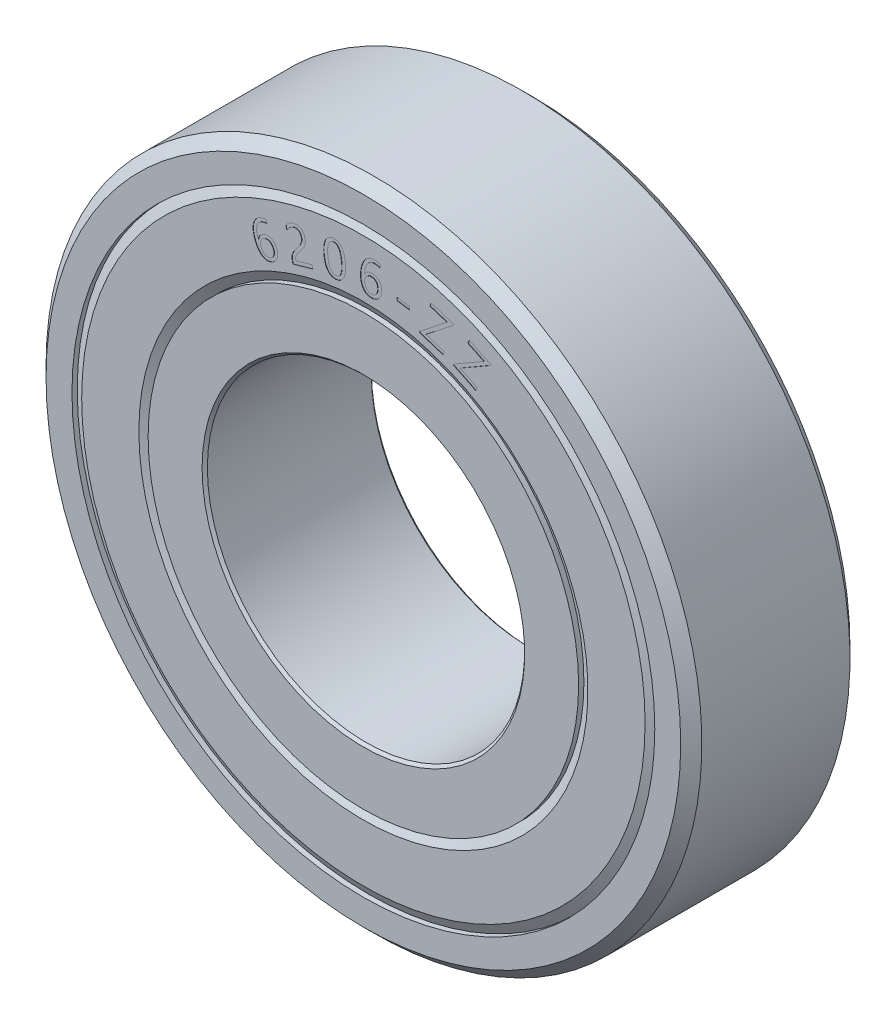
from build123d import *

# Parameters (mm, degrees)
WRAP1_START  = -0.03125
WRAP1_DEPTH  = 0.03125
SCALE2_SCALE = 0.564516129


# Read off the part's stored shape, not the designer's step: Wrap1
with BuildPart() as part:
    # Sketch1 → Revolve1 (revolve)
    with BuildSketch(Plane(origin=(0, 0, 0), x_dir=(0, 0, -1), z_dir=(1, 0, 0)), mode=Mode.PRIVATE) as revolve1_sk:
        Polygon((-15, 31), (-1, 31), (0, 30), (0, 27.55), (-0.5, 27.55), (0, 26.632766492), (0, 21.227178001), (-0.5, 20.35), (0, 20.35), (0, 15.25), (-0.25, 15), (-15.75, 15), (-16, 15.25), (-16, 20.35), (-15.5, 20.35), (-16, 21.227178001), (-16, 26.632766492), (-15.5, 27.55), (-16, 27.55), (-16, 30), align=None)
    revolve(revolve1_sk.sketch.rotate(Axis((0, 0, 0), (0, 0, 1)), 90), axis=Axis((0, 0, 0), (0, 0, 1)))

    # Wrap1 outline → Wrap1 (cut)
    # profile 1 of 7: a face of its own
    with BuildSketch(Plane.XY.offset(16).offset(WRAP1_START)):
        with BuildLine():
            add(Edge.make_bspline(
                [(-8.686815783, 20.117549912), (-8.722859253, 20.103195892), (-8.793303243, 20.075142142), (-8.902341071, 20.048318833), (-9.010387041, 20.035036667), (-9.117493542, 20.035487632), (-9.222631434, 20.05035074), (-9.325954759, 20.077121449), (-9.427100074, 20.117491532), (-9.526053483, 20.170719276), (-9.621873439, 20.236917247), (-9.714649586, 20.315724897), (-9.80465117, 20.406360164), (-9.890735386, 20.510296734), (-9.973382333, 20.625349673), (-10.050928825, 20.752581484), (-10.125874325, 20.889797402), (-10.169658996, 20.987351786), (-10.192068662, 21.037281614)],
                knots=[0, 0, 0, 0, 0.058625041, 0.114577812, 0.16927673, 0.222921005, 0.276072403, 0.32947385, 0.383986326, 0.440378705, 0.49907483, 0.5597953, 0.624256027, 0.69201223, 0.763706148, 0.838325487, 0.917252507, 1, 1, 1, 1], degree=3))
            add(Edge.make_bspline(
                [(-8.197249583, 21.482460479), (-8.182814772, 21.447469043), (-8.154474675, 21.378769792), (-8.124963946, 21.27265893), (-8.104053798, 21.167753573), (-8.095128489, 21.063350256), (-8.096006759, 20.961366535), (-8.104681526, 20.861836927), (-8.123812758, 20.765641411), (-8.152044208, 20.67283335), (-8.188253424, 20.583689078), (-8.234707833, 20.499496294), (-8.289418685, 20.419561321), (-8.35375917, 20.345389982), (-8.425272037, 20.276393507), (-8.505666518, 20.215845453), (-8.592679359, 20.161629725), (-8.655153947, 20.132375712), (-8.686815783, 20.117549912)],
                knots=[0, 0, 0, 0, 0.069936499, 0.13730746, 0.203276133, 0.267497732, 0.330668393, 0.391684228, 0.451970044, 0.511666229, 0.570843551, 0.629542941, 0.689140061, 0.749626942, 0.810812346, 0.872535145, 0.935401393, 1, 1, 1, 1], degree=3))
            add(Edge.make_bspline(
                [(-9.41398478, 22.01445575), (-9.38265969, 22.027264022), (-9.321603963, 22.052228623), (-9.227953703, 22.078517944), (-9.135599299, 22.094313007), (-9.044600249, 22.100079537), (-8.955272311, 22.09722025), (-8.868515037, 22.08374945), (-8.783987479, 22.062547391), (-8.702931612, 22.030495556), (-8.624468912, 21.991151698), (-8.550465264, 21.94193132), (-8.479256837, 21.885837175), (-8.41322184, 21.820250398), (-8.35058673, 21.747415808), (-8.293474439, 21.666501183), (-8.241383758, 21.577873998), (-8.212169109, 21.51471495), (-8.197249583, 21.482460479)],
                knots=[0, 0, 0, 0, 0.06789377, 0.132331738, 0.194804894, 0.255645807, 0.315089351, 0.373835547, 0.431572813, 0.489651074, 0.548449209, 0.607448177, 0.667750483, 0.730142659, 0.793958827, 0.86037386, 0.92869482, 1, 1, 1, 1], degree=3))
            add(Edge.make_bspline(
                [(-9.916606079, 21.366270101), (-9.912045259, 21.402609501), (-9.903113933, 21.473771912), (-9.87131608, 21.575060102), (-9.828298684, 21.668992957), (-9.771329205, 21.754693296), (-9.701331602, 21.832729558), (-9.617241393, 21.901571264), (-9.521665689, 21.964685496), (-9.450601051, 21.997531663), (-9.41398478, 22.01445575)],
                knots=[0, 0, 0, 0, 0.126822422, 0.248352732, 0.366544017, 0.484194201, 0.603918014, 0.728777904, 0.860251991, 1, 1, 1, 1], degree=3))
            Line((-9.916606079, 21.366270101), (-9.925091894, 21.362353571))
            add(Edge.make_bspline(
                [(-9.606547486, 22.944631532), (-9.637658803, 22.929971647), (-9.698886835, 22.901120543), (-9.782022458, 22.844896358), (-9.856190666, 22.780438308), (-9.920060125, 22.706985215), (-9.974778604, 22.626148933), (-10.018933176, 22.538125826), (-10.054521194, 22.443882253), (-10.080600753, 22.343480631), (-10.095991004, 22.236888903), (-10.101710316, 22.125025736), (-10.097446228, 22.007589072), (-10.083802216, 21.88512279), (-10.059334292, 21.758665835), (-10.02501889, 21.628745783), (-9.980942, 21.495569991), (-9.943969085, 21.407380376), (-9.925091894, 21.362353571)],
                knots=[0, 0, 0, 0, 0.057119755, 0.11241344, 0.166260519, 0.220107598, 0.273796414, 0.328166104, 0.383472809, 0.441042306, 0.500297207, 0.562254393, 0.627056894, 0.695502473, 0.76696116, 0.841031333, 0.91883567, 1, 1, 1, 1], degree=3))
            add(Edge.make_bspline(
                [(-9.083690783, 23.034711713), (-9.128989335, 23.036360887), (-9.218778327, 23.039629815), (-9.351904134, 23.023172447), (-9.482345795, 22.994163664), (-9.564921156, 22.961232279), (-9.606547486, 22.944631532)],
                knots=[0, 0, 0, 0, 0.253592012, 0.502660037, 0.749290378, 1, 1, 1, 1], degree=3))
            Line((-9.083690783, 23.034711713), (-9.220116565, 23.348034081))
            add(Edge.make_bspline(
                [(-9.737098473, 23.222052379), (-9.712588352, 23.232464798), (-9.665013108, 23.252675771), (-9.594122018, 23.27917572), (-9.525463719, 23.300284479), (-9.459725925, 23.319051272), (-9.396288939, 23.332854956), (-9.335217444, 23.341938466), (-9.276794742, 23.347475988), (-9.238622491, 23.347851859), (-9.220116565, 23.348034081)],
                knots=[0, 0, 0, 0, 0.149049533, 0.289311835, 0.423355869, 0.551000849, 0.671871767, 0.786410566, 0.896451737, 1, 1, 1, 1], degree=3))
            add(Edge.make_bspline(
                [(-10.192068662, 21.037281614), (-10.21793268, 21.099191903), (-10.268551991, 21.220358545), (-10.32866129, 21.4036111), (-10.376803532, 21.582069301), (-10.40835121, 21.756376293), (-10.427402089, 21.924981836), (-10.431130458, 22.087018372), (-10.422531467, 22.241932468), (-10.399798993, 22.389348308), (-10.363521043, 22.528590933), (-10.313491732, 22.659016381), (-10.250772952, 22.780704547), (-10.17401686, 22.892695699), (-10.084496137, 22.994668726), (-9.980964194, 23.083694787), (-9.865150782, 23.161369657), (-9.780323436, 23.201568497), (-9.737098473, 23.222052379)],
                knots=[0, 0, 0, 0, 0.080647521, 0.157837891, 0.231704099, 0.30272489, 0.370620794, 0.435523077, 0.497375405, 0.556949247, 0.61456941, 0.670056373, 0.724585825, 0.778793611, 0.832915465, 0.887258822, 0.942551153, 1, 1, 1, 1], degree=3))
        make_face()
        with BuildLine():
            add(Edge.make_bspline(
                [(-9.36633367, 21.701786137), (-9.386359326, 21.692417938), (-9.425705507, 21.674011409), (-9.480160881, 21.639462231), (-9.530303183, 21.600888479), (-9.575256578, 21.557147313), (-9.614617436, 21.509445932), (-9.650054055, 21.459747964), (-9.678384839, 21.406285343), (-9.702862752, 21.351082946), (-9.721092458, 21.293485969), (-9.733438754, 21.23419742), (-9.740732361, 21.173699926), (-9.74197743, 21.112050891), (-9.737397725, 21.050202246), (-9.727024979, 20.988488017), (-9.709996881, 20.927493903), (-9.694171849, 20.888102387), (-9.686183588, 20.868218086)],
                knots=[0, 0, 0, 0, 0.066694962, 0.1310415, 0.194251108, 0.257436812, 0.319935694, 0.38080777, 0.441367059, 0.502271034, 0.562940694, 0.623371559, 0.684896011, 0.746665513, 0.809247212, 0.871890951, 0.935332296, 1, 1, 1, 1], degree=3))
            add(Edge.make_bspline(
                [(-8.51840501, 21.292508793), (-8.5296007, 21.3170435), (-8.551354064, 21.36471474), (-8.588931372, 21.432042197), (-8.629793445, 21.493138852), (-8.673736117, 21.548343549), (-8.720212962, 21.597514151), (-8.768843529, 21.640788122), (-8.820486027, 21.677013213), (-8.873960489, 21.707233972), (-8.929806854, 21.73083394), (-8.987539229, 21.748158542), (-9.047440885, 21.757678689), (-9.108951541, 21.761185101), (-9.171946366, 21.75682767), (-9.236358722, 21.746570867), (-9.301766679, 21.728162416), (-9.344514273, 21.710699585), (-9.36633367, 21.701786137)],
                knots=[0, 0, 0, 0, 0.075921985, 0.14751736, 0.216853669, 0.282690345, 0.345971109, 0.407186124, 0.465665977, 0.523275869, 0.579836756, 0.636061433, 0.692572514, 0.750250794, 0.80918789, 0.870030717, 0.933660562, 1, 1, 1, 1], degree=3))
            add(Edge.make_bspline(
                [(-8.795825857, 20.406067593), (-8.775560354, 20.415394951), (-8.735641396, 20.433767967), (-8.681087075, 20.468787022), (-8.631193841, 20.507425206), (-8.587619402, 20.551474758), (-8.549003066, 20.599063528), (-8.516164747, 20.649980863), (-8.489992805, 20.704302907), (-8.468973646, 20.761078452), (-8.453969464, 20.820830287), (-8.444905871, 20.882936565), (-8.441678896, 20.947408925), (-8.444475717, 21.014006585), (-8.45276162, 21.082434148), (-8.468161234, 21.152026534), (-8.489476269, 21.222659195), (-8.5086442, 21.268940929), (-8.51840501, 21.292508793)],
                knots=[0, 0, 0, 0, 0.064137033, 0.126337031, 0.186096352, 0.245434177, 0.304214204, 0.362235401, 0.419371141, 0.477422746, 0.536202773, 0.596338261, 0.657789751, 0.721715479, 0.787972893, 0.855899167, 0.926620104, 1, 1, 1, 1], degree=3))
            add(Edge.make_bspline(
                [(-9.686183588, 20.868218086), (-9.675036646, 20.843871081), (-9.653132691, 20.796028745), (-9.613970828, 20.728320193), (-9.571284604, 20.664853471), (-9.523406352, 20.606932785), (-9.472646905, 20.554031168), (-9.419267315, 20.506890409), (-9.363087114, 20.46622069), (-9.305453816, 20.430601405), (-9.245035442, 20.402664249), (-9.183229139, 20.380816862), (-9.120009196, 20.365722668), (-9.055434728, 20.357926796), (-8.990101375, 20.356875775), (-8.924630606, 20.365155361), (-8.859111454, 20.380520524), (-8.817178356, 20.397448037), (-8.795825857, 20.406067593)],
                knots=[0, 0, 0, 0, 0.071810448, 0.141108922, 0.209603514, 0.276804573, 0.342453494, 0.406160557, 0.467582333, 0.528357017, 0.587644182, 0.645805392, 0.70400468, 0.761644941, 0.820028409, 0.878827795, 0.938298637, 1, 1, 1, 1], degree=3))
        make_face(mode=Mode.SUBTRACT)
    # profile 2 of 7: a face of its own
    with BuildSketch(Plane.XY.offset(16).offset(WRAP1_START)):
        with BuildLine():
            add(Edge.make_bspline(
                [(0.707680968, 21.901129933), (0.669042669, 21.903137915), (0.593316991, 21.907073279), (0.483804794, 21.930514225), (0.380056427, 21.963115662), (0.283713007, 22.010090335), (0.194582083, 22.06839335), (0.113051858, 22.13789865), (0.038257743, 22.217070291), (-0.028698729, 22.307359166), (-0.087302221, 22.408167188), (-0.137475825, 22.51922493), (-0.179727656, 22.639844993), (-0.214524532, 22.770026352), (-0.239336419, 22.909832536), (-0.256302485, 23.058057614), (-0.264093564, 23.214612925), (-0.262485121, 23.321520458), (-0.261660109, 23.376356085)],
                knots=[0, 0, 0, 0, 0.058389355, 0.114434994, 0.168721187, 0.222406407, 0.275856428, 0.32929026, 0.383960576, 0.440129574, 0.4987878, 0.559861289, 0.624035465, 0.691759102, 0.763293468, 0.838431909, 0.917127566, 1, 1, 1, 1], degree=3))
            add(Edge.make_bspline(
                [(1.73315897, 22.9285662), (1.731317501, 22.890629486), (1.727700362, 22.816111551), (1.709217137, 22.707456812), (1.683600927, 22.603415751), (1.647558598, 22.505206699), (1.603583706, 22.413063743), (1.553417837, 22.326708001), (1.495107545, 22.247774057), (1.430209561, 22.175612626), (1.359092525, 22.110554811), (1.280809715, 22.054373304), (1.196833235, 22.005878222), (1.107340143, 21.965201977), (1.012779084, 21.934067417), (0.914202376, 21.912222984), (0.811949494, 21.901189608), (0.742734971, 21.901149995), (0.707680968, 21.901129933)],
                knots=[0, 0, 0, 0, 0.070070298, 0.137636957, 0.203115814, 0.2676787, 0.330395244, 0.391442525, 0.451787784, 0.511242502, 0.570399214, 0.629385156, 0.688784197, 0.749197621, 0.810560032, 0.872263436, 0.93530725, 1, 1, 1, 1], degree=3))
            add(Edge.make_bspline(
                [(0.859120113, 23.928586759), (0.892694849, 23.926878689), (0.958695752, 23.92352098), (1.054479383, 23.90692302), (1.144998179, 23.881971036), (1.229923053, 23.848763048), (1.309208798, 23.807388775), (1.382697097, 23.75907912), (1.449706708, 23.703248161), (1.509949466, 23.64025254), (1.563454234, 23.570709533), (1.610890351, 23.49561163), (1.650013871, 23.41367974), (1.682511893, 23.326297698), (1.708133672, 23.233764829), (1.724845765, 23.136035282), (1.734379575, 23.033852062), (1.733570364, 22.964051902), (1.73315897, 22.9285662)],
                knots=[0, 0, 0, 0, 0.067410169, 0.13251428, 0.194589033, 0.255560699, 0.315123183, 0.373733896, 0.431705252, 0.489760401, 0.548273457, 0.607513411, 0.667658746, 0.730105515, 0.79440083, 0.860009553, 0.928830258, 1, 1, 1, 1], degree=3))
            add(Edge.make_bspline(
                [(0.126729077, 23.555863692), (0.146566339, 23.586722802), (0.185259214, 23.646913954), (0.256598664, 23.725609145), (0.335807691, 23.792243176), (0.424207077, 23.845563944), (0.521149352, 23.885594408), (0.626182748, 23.91370664), (0.740091471, 23.928742576), (0.818607648, 23.928639793), (0.859120113, 23.928586759)],
                knots=[0, 0, 0, 0, 0.126868955, 0.247459778, 0.366228683, 0.484218121, 0.603452259, 0.728297714, 0.859808133, 1, 1, 1, 1], degree=3))
            Line((0.126729077, 23.555863692), (0.117590507, 23.556516447))
            add(Edge.make_bspline(
                [(1.08105679, 24.853540501), (1.046619704, 24.853327651), (0.978908288, 24.852909138), (0.87958819, 24.837250734), (0.784748564, 24.810890107), (0.695703436, 24.770905318), (0.611837001, 24.721428015), (0.534018255, 24.6608926), (0.461490584, 24.591149012), (0.39530933, 24.510887806), (0.336191689, 24.421105397), (0.282878028, 24.322478008), (0.236898329, 24.214391409), (0.19702328, 24.09776186), (0.165450549, 23.97257542), (0.140562519, 23.840312734), (0.124218283, 23.700701101), (0.119832794, 23.605296498), (0.117590507, 23.556516447)],
                knots=[0, 0, 0, 0, 0.057153846, 0.112377914, 0.166510623, 0.220254359, 0.274075872, 0.327952004, 0.383694398, 0.440957922, 0.500421996, 0.56205684, 0.62700152, 0.695374093, 0.766666835, 0.841336777, 0.91887603, 1, 1, 1, 1], degree=3))
            add(Edge.make_bspline(
                [(1.592163904, 24.71189268), (1.551940073, 24.732555796), (1.472181966, 24.7735278), (1.344975137, 24.815654217), (1.214676731, 24.845543132), (1.125826894, 24.850860938), (1.08105679, 24.853540501)],
                knots=[0, 0, 0, 0, 0.253114679, 0.501890232, 0.749009943, 1, 1, 1, 1], degree=3))
            Line((1.592163904, 24.71189268), (1.602607983, 25.053283511))
            add(Edge.make_bspline(
                [(1.08105679, 25.159682565), (1.107614517, 25.158589432), (1.159270301, 25.156463247), (1.234829849, 25.149809319), (1.306261353, 25.14077106), (1.373729722, 25.129446236), (1.436666264, 25.113803495), (1.496057432, 25.097531984), (1.551190532, 25.077179657), (1.585734943, 25.061125218), (1.602607983, 25.053283511)],
                knots=[0, 0, 0, 0, 0.148703102, 0.289233159, 0.424228116, 0.551521341, 0.671699774, 0.786916864, 0.895920644, 1, 1, 1, 1], degree=3))
            add(Edge.make_bspline(
                [(-0.261660109, 23.376356085), (-0.258515414, 23.443425865), (-0.25236423, 23.574617768), (-0.230343463, 23.766175341), (-0.196292104, 23.947817131), (-0.15160386, 24.11937121), (-0.096329089, 24.279754808), (-0.031714794, 24.428450391), (0.042855691, 24.56437758), (0.125603315, 24.688613161), (0.217667151, 24.79919183), (0.318207671, 24.896189142), (0.427325006, 24.978983713), (0.5442674, 25.047990243), (0.669373931, 25.101191993), (0.800883961, 25.138447443), (0.939156455, 25.159393198), (1.033118077, 25.159584807), (1.08105679, 25.159682565)],
                knots=[0, 0, 0, 0, 0.080677799, 0.157809879, 0.231509189, 0.302609793, 0.370669291, 0.435188578, 0.497213011, 0.556756917, 0.614310713, 0.669793215, 0.72428962, 0.77855592, 0.832566452, 0.887199453, 0.942449769, 1, 1, 1, 1], degree=3))
        make_face()
        with BuildLine():
            add(Edge.make_bspline(
                [(0.768387177, 23.625055715), (0.746399512, 23.625010818), (0.702947513, 23.624922093), (0.638684197, 23.618006817), (0.576971492, 23.603089397), (0.517508977, 23.583256789), (0.461775932, 23.556728429), (0.40852988, 23.526854035), (0.36005899, 23.490669135), (0.314576601, 23.45077217), (0.273571096, 23.40664654), (0.237552303, 23.358080927), (0.204517408, 23.306866648), (0.177375154, 23.251299257), (0.15540482, 23.193322302), (0.137790422, 23.13346698), (0.127616185, 23.071181561), (0.124858318, 23.02890414), (0.123465302, 23.007549547)],
                knots=[0, 0, 0, 0, 0.066393817, 0.131207386, 0.194657015, 0.257840578, 0.320177571, 0.38082871, 0.441955161, 0.502485104, 0.563409824, 0.623481308, 0.684928451, 0.747241187, 0.809858193, 0.872059917, 0.935376652, 1, 1, 1, 1], degree=3))
            add(Edge.make_bspline(
                [(1.361741412, 22.893317433), (1.361824473, 22.920084099), (1.3619874, 22.972587451), (1.35714076, 23.049464116), (1.345848684, 23.1223265), (1.329729122, 23.191186597), (1.308027356, 23.255414181), (1.282933903, 23.315826659), (1.251311082, 23.370356351), (1.215829611, 23.420499349), (1.176203335, 23.466098299), (1.130351807, 23.505170922), (1.080885986, 23.540202354), (1.026062396, 23.568849982), (0.967455296, 23.592260839), (0.904764796, 23.610204009), (0.83793867, 23.621180666), (0.791925209, 23.623744297), (0.768387177, 23.625055715)],
                knots=[0, 0, 0, 0, 0.075352881, 0.147806187, 0.216598188, 0.282719789, 0.346648263, 0.407299232, 0.466566966, 0.523680661, 0.5801002, 0.636115867, 0.692876933, 0.75042593, 0.80980753, 0.870309815, 0.933657417, 1, 1, 1, 1], degree=3))
            add(Edge.make_bspline(
                [(0.73313841, 22.208577507), (0.755355448, 22.208531428), (0.799073565, 22.208440755), (0.863413425, 22.216585243), (0.924990926, 22.230743158), (0.983353463, 22.251867115), (1.038235948, 22.278644446), (1.089475031, 22.31077838), (1.136737519, 22.348221521), (1.180060681, 22.390910559), (1.218960876, 22.438554368), (1.254145505, 22.490558393), (1.283857661, 22.547750459), (1.310091147, 22.609197421), (1.331677461, 22.674851105), (1.347122379, 22.744628668), (1.35775355, 22.817738163), (1.360396311, 22.867824642), (1.361741412, 22.893317433)],
                knots=[0, 0, 0, 0, 0.063863538, 0.125669034, 0.18610247, 0.245307623, 0.303820372, 0.361483109, 0.418968883, 0.476956904, 0.536109083, 0.595660709, 0.65726616, 0.721215545, 0.787730041, 0.855764831, 0.926587831, 1, 1, 1, 1], degree=3))
            add(Edge.make_bspline(
                [(0.123465302, 23.007549547), (0.123230364, 22.980770143), (0.122767336, 22.927991753), (0.129906684, 22.849941119), (0.140982507, 22.774011406), (0.159748999, 22.701067469), (0.182550692, 22.631336419), (0.212208923, 22.566406574), (0.244039346, 22.504752788), (0.282226401, 22.448496007), (0.324789805, 22.397485129), (0.371329951, 22.351253331), (0.422560495, 22.310920204), (0.477147764, 22.275168846), (0.53630158, 22.247201344), (0.59884559, 22.225933029), (0.664963471, 22.21290305), (0.71023786, 22.210030494), (0.73313841, 22.208577507)],
                knots=[0, 0, 0, 0, 0.071690568, 0.1412919, 0.209709395, 0.276995448, 0.342793415, 0.405935819, 0.467990205, 0.528447497, 0.587624209, 0.645735108, 0.703807999, 0.762009434, 0.820143711, 0.878569419, 0.938578362, 1, 1, 1, 1], degree=3))
        make_face(mode=Mode.SUBTRACT)
    # profile 3 of 7: a face of its own
    with BuildSketch(Plane.XY.offset(16).offset(WRAP1_START)):
        with BuildLine():
            add(Edge.make_bspline(
                [(-2.572297646, 21.745813176), (-2.610796657, 21.742786653), (-2.686115637, 21.736865603), (-2.797364409, 21.746218194), (-2.90362292, 21.767510526), (-3.004823896, 21.802849566), (-3.099934037, 21.852534468), (-3.18937498, 21.914159753), (-3.272045397, 21.989114764), (-3.349354829, 22.075532988), (-3.4199735, 22.174854024), (-3.483557513, 22.286510405), (-3.542075031, 22.409545364), (-3.592286088, 22.545220711), (-3.6370898, 22.692198529), (-3.67247588, 22.851289232), (-3.7041215, 23.020951818), (-3.717524014, 23.138467275), (-3.724410105, 23.198845659)],
                knots=[0, 0, 0, 0, 0.055591359, 0.108758234, 0.160309058, 0.211497889, 0.262704016, 0.314561211, 0.367649379, 0.423185844, 0.481417946, 0.542967689, 0.608211854, 0.677598235, 0.751326758, 0.829546457, 0.912422504, 1, 1, 1, 1], degree=3))
            add(Edge.make_bspline(
                [(-1.693689505, 23.489321605), (-1.687741888, 23.42561774), (-1.676167649, 23.301648114), (-1.671310788, 23.120080511), (-1.675435274, 22.948771533), (-1.689530489, 22.787805885), (-1.713411808, 22.637687855), (-1.746624696, 22.498375502), (-1.788838313, 22.370030476), (-1.840106464, 22.252513666), (-1.901338341, 22.146833702), (-1.970203791, 22.051576565), (-2.050313349, 21.969690091), (-2.13796913, 21.898452858), (-2.234743334, 21.839809669), (-2.340042833, 21.79479672), (-2.453267106, 21.762271957), (-2.532075229, 21.751374874), (-2.572297646, 21.745813176)],
                knots=[0, 0, 0, 0, 0.087585536, 0.17044407, 0.248529309, 0.32211233, 0.391516987, 0.456479845, 0.518001271, 0.576293412, 0.631687369, 0.684959197, 0.736790272, 0.78806522, 0.839262209, 0.891174565, 0.944457222, 1, 1, 1, 1], degree=3))
            add(Edge.make_bspline(
                [(-2.846454719, 24.990005199), (-2.806445318, 24.993177421), (-2.728797961, 24.999333842), (-2.614222207, 24.991834203), (-2.50644679, 24.970878127), (-2.404217062, 24.937937778), (-2.309777604, 24.889068578), (-2.220548087, 24.828880623), (-2.138569332, 24.753863264), (-2.06263159, 24.666112881), (-1.994240269, 24.564370537), (-1.931298862, 24.450246201), (-1.875604095, 24.322455407), (-1.825986686, 24.181505298), (-1.783470373, 24.027147408), (-1.746347206, 23.859857312), (-1.715548727, 23.679256925), (-1.701136165, 23.554025819), (-1.693689505, 23.489321605)],
                knots=[0, 0, 0, 0, 0.056329036, 0.109319327, 0.160697138, 0.210286926, 0.259638717, 0.30957776, 0.361087262, 0.415265123, 0.47224155, 0.53298908, 0.598137278, 0.667844842, 0.742754497, 0.822926167, 0.908509766, 1, 1, 1, 1], degree=3))
            add(Edge.make_bspline(
                [(-3.724410105, 23.198845659), (-3.73041768, 23.265383213), (-3.742064776, 23.394381897), (-3.749703824, 23.583052496), (-3.746235338, 23.760415966), (-3.734704904, 23.926880301), (-3.711627773, 24.081906662), (-3.68028576, 24.225447314), (-3.639187386, 24.357364818), (-3.588226657, 24.4771833), (-3.528649717, 24.585822893), (-3.457930174, 24.68129883), (-3.37868509, 24.76505334), (-3.289720884, 24.836206122), (-3.191519378, 24.894771183), (-3.084401488, 24.940465954), (-2.96860192, 24.973757026), (-2.887775158, 24.984508703), (-2.846454719, 24.990005199)],
                knots=[0, 0, 0, 0, 0.089294896, 0.17311914, 0.252242165, 0.326323021, 0.396000729, 0.461554359, 0.522540886, 0.580398444, 0.635343397, 0.687755128, 0.738773238, 0.789055673, 0.839533717, 0.891128059, 0.944342241, 1, 1, 1, 1], degree=3))
        make_face()
        with BuildLine():
            add(Edge.make_bspline(
                [(-2.83209411, 24.68451589), (-2.859258762, 24.680810054), (-2.912105842, 24.67360059), (-2.986983831, 24.648502103), (-3.055608953, 24.614342065), (-3.118464366, 24.570452001), (-3.17379168, 24.51497578), (-3.222852466, 24.449900664), (-3.265347583, 24.374755475), (-3.300959704, 24.289803558), (-3.331069894, 24.19526969), (-3.354280265, 24.090381987), (-3.370678846, 23.975361345), (-3.382036502, 23.85052799), (-3.385240224, 23.715616824), (-3.383091661, 23.570837569), (-3.375639966, 23.415736142), (-3.365014058, 23.309340201), (-3.359520097, 23.254329829)],
                knots=[0, 0, 0, 0, 0.048460173, 0.094276144, 0.139079573, 0.183873059, 0.229375235, 0.277232686, 0.327797928, 0.381833645, 0.440082181, 0.503274858, 0.571827387, 0.645714674, 0.725124503, 0.81067362, 0.902111729, 1, 1, 1, 1], degree=3))
            add(Edge.make_bspline(
                [(-2.056621248, 23.415560298), (-2.062744905, 23.469358116), (-2.074622389, 23.573704713), (-2.098478993, 23.724273071), (-2.124459493, 23.864333143), (-2.156185496, 23.992877452), (-2.190020221, 24.110936545), (-2.229570765, 24.21751713), (-2.271512926, 24.313842088), (-2.31765416, 24.399442788), (-2.368671937, 24.473452811), (-2.423110795, 24.537025016), (-2.481370091, 24.589946562), (-2.544002669, 24.63172255), (-2.610762322, 24.662254757), (-2.681328631, 24.681206618), (-2.755810881, 24.689328961), (-2.806200532, 24.686149639), (-2.83209411, 24.68451589)],
                knots=[0, 0, 0, 0, 0.098545731, 0.191139937, 0.277438299, 0.357744763, 0.432061694, 0.500854239, 0.564512789, 0.623179147, 0.677560643, 0.727822819, 0.775219463, 0.820366822, 0.864322339, 0.908229652, 0.952842249, 1, 1, 1, 1], degree=3))
            add(Edge.make_bspline(
                [(-2.569033872, 22.05587177), (-2.54298237, 22.059453803), (-2.492009565, 22.06646247), (-2.419401873, 22.089875648), (-2.352940897, 22.122616123), (-2.292548286, 22.165065255), (-2.23859226, 22.217386082), (-2.19082025, 22.279210247), (-2.14959896, 22.350715779), (-2.114441319, 22.43129199), (-2.085957198, 22.521524135), (-2.063370622, 22.621102947), (-2.0464326, 22.730359874), (-2.036560547, 22.849220453), (-2.031882072, 22.977529134), (-2.034375827, 23.115170048), (-2.042095678, 23.26236585), (-2.051672598, 23.363369179), (-2.056621248, 23.415560298)],
                knots=[0, 0, 0, 0, 0.048710566, 0.095307912, 0.140801117, 0.185710312, 0.231673891, 0.279717526, 0.33018932, 0.384415126, 0.442500286, 0.505463908, 0.573689088, 0.647440568, 0.726610532, 0.811793726, 0.902748789, 1, 1, 1, 1], degree=3))
            add(Edge.make_bspline(
                [(-3.359520097, 23.254329829), (-3.353605965, 23.203144711), (-3.342177106, 23.104231205), (-3.319133782, 22.961406043), (-3.292628021, 22.828944288), (-3.262290819, 22.706554624), (-3.227243322, 22.594904286), (-3.187926986, 22.4937515), (-3.145315248, 22.402524862), (-3.09753744, 22.321950005), (-3.04625827, 22.251434766), (-2.990091904, 22.192065389), (-2.930484009, 22.142173322), (-2.865900841, 22.103437366), (-2.797385447, 22.07467789), (-2.724545641, 22.058169953), (-2.647895978, 22.050339617), (-2.595798194, 22.053994261), (-2.569033872, 22.05587177)],
                knots=[0, 0, 0, 0, 0.096516094, 0.186514084, 0.270930708, 0.349525354, 0.422620362, 0.489989114, 0.55271016, 0.611011903, 0.665226205, 0.715686548, 0.763753996, 0.810380925, 0.85625344, 0.902326537, 0.949821971, 1, 1, 1, 1], degree=3))
        make_face(mode=Mode.SUBTRACT)
    # profile 4 of 7: a face of its own
    with BuildSketch(Plane.XY.offset(16).offset(WRAP1_START)):
        with BuildLine():
            add(Edge.make_bspline(
                [(-6.601340088, 24.001248637), (-6.634610472, 23.990507465), (-6.701197779, 23.969010095), (-6.793835638, 23.91845711), (-6.88117587, 23.858063427), (-6.962737117, 23.787495492), (-7.0378873, 23.707076731), (-7.107327289, 23.619346873), (-7.170705012, 23.524703409), (-7.205765317, 23.456994236), (-7.223415541, 23.422907765)],
                knots=[0, 0, 0, 0, 0.119855874, 0.239879411, 0.360747019, 0.484211769, 0.609517769, 0.738264798, 0.868236033, 1, 1, 1, 1], degree=3))
            add(Edge.make_bspline(
                [(-5.883309661, 23.607637412), (-5.890353503, 23.629954638), (-5.904089989, 23.673476377), (-5.929910882, 23.734647565), (-5.960331589, 23.789785246), (-5.994865356, 23.838705334), (-6.03305387, 23.881895412), (-6.073484914, 23.920297549), (-6.117455165, 23.952353904), (-6.164062084, 23.978539581), (-6.212769012, 23.999266696), (-6.263162413, 24.016427124), (-6.316455799, 24.025389939), (-6.371214878, 24.030996997), (-6.42758452, 24.030599747), (-6.485025346, 24.026245285), (-6.543294733, 24.016331238), (-6.581823491, 24.006319862), (-6.601340088, 24.001248637)],
                knots=[0, 0, 0, 0, 0.075759873, 0.147742445, 0.214607958, 0.279318811, 0.341229975, 0.40105291, 0.459541336, 0.51696317, 0.573772152, 0.630816621, 0.688861946, 0.74831858, 0.808916648, 0.871119838, 0.934716237, 1, 1, 1, 1], degree=3))
            add(Edge.make_bspline(
                [(-6.207728863, 22.542341359), (-6.186692099, 22.569425358), (-6.146058381, 22.621739657), (-6.089442598, 22.699597031), (-6.040142373, 22.774512705), (-5.996282062, 22.846088566), (-5.959178375, 22.915878887), (-5.925998135, 22.983127978), (-5.900132092, 23.04979799), (-5.878212756, 23.114343815), (-5.86172752, 23.178032995), (-5.850617809, 23.240665212), (-5.844539153, 23.302233257), (-5.844061742, 23.383271393), (-5.85299068, 23.486104392), (-5.873048522, 23.566505846), (-5.883309661, 23.607637412)],
                knots=[0, 0, 0, 0, 0.088400926, 0.170751464, 0.248065885, 0.319536114, 0.387040428, 0.451763508, 0.512693579, 0.571224616, 0.627408185, 0.682090682, 0.73505479, 0.786659075, 0.890859604, 1, 1, 1, 1], degree=3))
            add(Edge.make_bspline(
                [(-6.693378534, 21.112808053), (-6.701804731, 21.144485294), (-6.718207572, 21.206149738), (-6.7358847, 21.297481627), (-6.74659573, 21.384508563), (-6.750093032, 21.467918085), (-6.746141876, 21.549188943), (-6.734812316, 21.629962164), (-6.716767004, 21.710905362), (-6.690105763, 21.792027561), (-6.655509792, 21.873913137), (-6.614525427, 21.958267531), (-6.565214702, 22.044301316), (-6.508382052, 22.133104424), (-6.443578877, 22.226146827), (-6.37189483, 22.325744611), (-6.292943438, 22.43235534), (-6.236809513, 22.504807112), (-6.207728863, 22.542341359)],
                knots=[0, 0, 0, 0, 0.061980301, 0.120653841, 0.175779782, 0.227671316, 0.278347685, 0.329445027, 0.381757465, 0.434982907, 0.490695539, 0.549773198, 0.612248783, 0.678117974, 0.749118099, 0.826663046, 0.910201339, 1, 1, 1, 1], degree=3))
            Line((-6.693378534, 21.112808053), (-6.650296709, 20.962021663))
            Line((-6.650296709, 20.962021663), (-4.772320763, 21.49728071))
            Line((-4.772320763, 21.49728071), (-4.861095434, 21.809297568))
            Line((-4.861095434, 21.809297568), (-6.376139636, 21.377173802))
            add(Edge.make_bspline(
                [(-5.902892309, 22.452261178), (-5.930228801, 22.418208738), (-5.982522708, 22.353067419), (-6.055280134, 22.258018339), (-6.121593894, 22.172089427), (-6.179910099, 22.09331466), (-6.231812695, 22.021272203), (-6.275612304, 21.952834833), (-6.313695879, 21.888712543), (-6.344866274, 21.827512191), (-6.369164004, 21.768991985), (-6.388091046, 21.712636347), (-6.399489661, 21.657582699), (-6.406560345, 21.603901016), (-6.407173507, 21.549790649), (-6.401324723, 21.49420236), (-6.391957131, 21.436031087), (-6.381498332, 21.397113639), (-6.376139636, 21.377173802)],
                knots=[0, 0, 0, 0, 0.106586134, 0.203896147, 0.292171502, 0.371521177, 0.443140967, 0.508846961, 0.569786444, 0.625129514, 0.676320817, 0.724356612, 0.769983044, 0.813329944, 0.856353514, 0.901697772, 0.949633633, 1, 1, 1, 1], degree=3))
            add(Edge.make_bspline(
                [(-5.537349546, 23.738188399), (-5.529248106, 23.708708463), (-5.51340679, 23.651064269), (-5.498358187, 23.564697799), (-5.487932182, 23.481274447), (-5.484847132, 23.400064684), (-5.487404998, 23.320660786), (-5.495760422, 23.242244471), (-5.511171, 23.164718342), (-5.531387445, 23.087243912), (-5.557465115, 23.009886326), (-5.59058574, 22.933062058), (-5.62839636, 22.855419855), (-5.673080489, 22.777982968), (-5.723413749, 22.699546862), (-5.777181787, 22.618034647), (-5.838190897, 22.535743129), (-5.881031859, 22.480466946), (-5.902892309, 22.452261178)],
                knots=[0, 0, 0, 0, 0.065483489, 0.128044476, 0.187676471, 0.245544914, 0.301998286, 0.357818364, 0.414335252, 0.471226015, 0.529325082, 0.589084562, 0.650395748, 0.714306355, 0.780540948, 0.85012003, 0.923520774, 1, 1, 1, 1], degree=3))
            add(Edge.make_bspline(
                [(-6.642463649, 24.308696211), (-6.611680591, 24.316821309), (-6.551242612, 24.332773736), (-6.459926195, 24.347647542), (-6.370188949, 24.355100872), (-6.282201676, 24.354178785), (-6.196408204, 24.346995646), (-6.114130763, 24.33021225), (-6.034875074, 24.307060333), (-5.959958955, 24.274530264), (-5.888113278, 24.235894073), (-5.822168726, 24.187202138), (-5.759427712, 24.132368692), (-5.70230019, 24.068902089), (-5.650247334, 23.998076332), (-5.60515631, 23.918970045), (-5.566266715, 23.832036354), (-5.547143331, 23.769973209), (-5.537349546, 23.738188399)],
                knots=[0, 0, 0, 0, 0.068112827, 0.133729457, 0.197739725, 0.260614921, 0.321880912, 0.381706751, 0.440055045, 0.498273084, 0.55622038, 0.614259309, 0.673318867, 0.734315198, 0.796634249, 0.861102034, 0.928865263, 1, 1, 1, 1], degree=3))
            add(Edge.make_bspline(
                [(-7.329814595, 23.796283588), (-7.311483767, 23.826284302), (-7.275277872, 23.885539819), (-7.210871155, 23.966712351), (-7.141272155, 24.041491835), (-7.063682237, 24.109248017), (-6.976110382, 24.170181839), (-6.876523199, 24.224140523), (-6.76423852, 24.271251963), (-6.684048473, 24.295909398), (-6.642463649, 24.308696211)],
                knots=[0, 0, 0, 0, 0.119596323, 0.236219113, 0.352039226, 0.467022429, 0.586211989, 0.714503794, 0.851947843, 1, 1, 1, 1], degree=3))
            Line((-7.329814595, 23.796283588), (-7.223415541, 23.422907765))
        make_face()
    # profile 5 of 7: a face of its own
    with BuildSketch(Plane.XY.offset(16).offset(WRAP1_START)):
        Polygon((7.645703332, 20.945337925), (5.922430306, 21.498874109), (8.524964228, 23.541997053), (8.552379936, 23.62620244), (6.400899673, 24.31681716), (6.297764393, 23.996967242), (7.906805306, 23.479985334), (5.323854031, 21.447306469), (5.292521794, 21.348740474), (7.543220807, 20.626140762), align=None)
    # profile 6 of 7: a face of its own
    with BuildSketch(Plane.XY.offset(16).offset(WRAP1_START)):
        Polygon((10.774180087, 19.555520111), (9.15143132, 20.343395316), (12.006581403, 21.994212545), (12.045093944, 22.073195892), (10.018942628, 23.056897578), (9.872725523, 22.755977553), (11.38842248, 22.020322742), (8.553507801, 20.376033063), (8.50846771, 20.283341862), (10.627962982, 19.254600086), align=None)
    # profile 7 of 7: a face of its own
    with BuildSketch(Plane.XY.offset(16).offset(WRAP1_START)):
        Polygon((3.196608393, 23.17489352), (3.153526567, 22.893556143), (4.344804322, 22.711437516), (4.387886148, 22.992774893), align=None)
    extrude(amount=WRAP1_DEPTH, mode=Mode.SUBTRACT)


with BuildPart() as part_1:
    # Scale2: scaled about (-1.107e-06, -0.000294066, 7.999895396)
    add(part.part.scale(SCALE2_SCALE).moved(Location((-4.82e-07, -0.000128061, 3.483825414))))


solid = part_1.part
